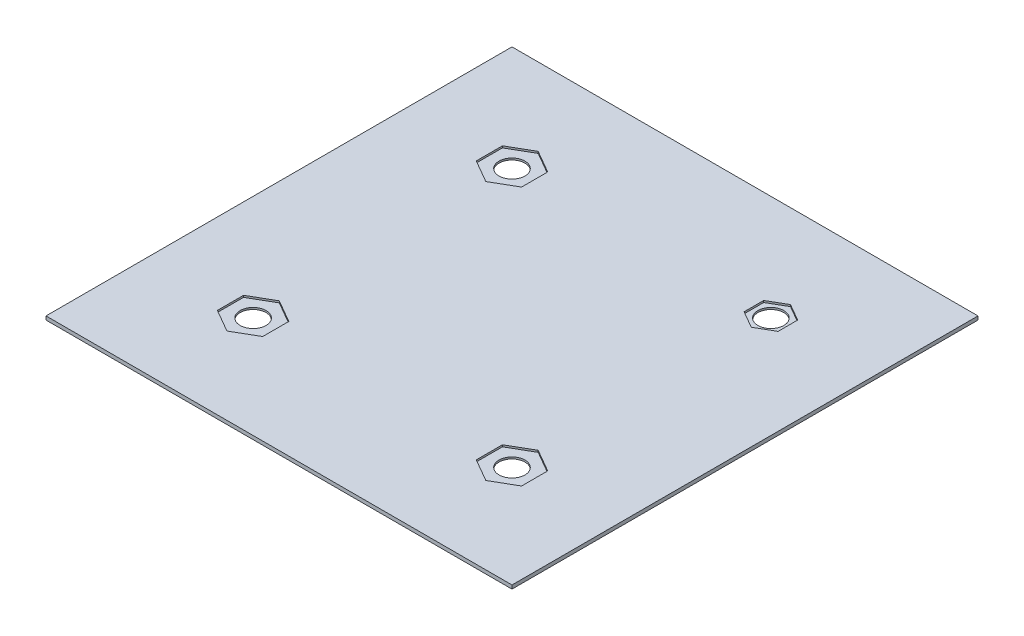
from build123d import *

# Parameters (mm, degrees)
SKETCH1_W           = 114.3
SKETCH1_H           = 114.3
BOSS_EXTRUDE1_DEPTH = 0.889
SKETCH2_R           = 3.175
CUT_EXTRUDE1_DEPTH  = 10
CUT_EXTRUDE2_DEPTH  = 0.4445


with BuildPart() as part:
    # Sketch1 → Boss-Extrude1 (new body)
    with BuildSketch(Plane(origin=(0, 0, 0), x_dir=(1, 0, 0), z_dir=(0, 1, 0))):
        with Locations((-26.758092486, 8.589017341)):
            Rectangle(SKETCH1_W, SKETCH1_H)
    extrude(amount=BOSS_EXTRUDE1_DEPTH)

    # Sketch2 → Cut-Extrude1 (cut)
    with BuildSketch(Plane(origin=(0, 0.889, 0), x_dir=(1, 0, 0), z_dir=(0, 1, 0))):
        with Locations((-58.508092486, 40.339017341)):
            Circle(SKETCH2_R)
        with Locations((4.991907514, 40.339017341)):
            Circle(SKETCH2_R)
        with Locations((-58.508092486, -23.160982659)):
            Circle(SKETCH2_R)
        with Locations((4.991907514, -23.160982659)):
            Circle(SKETCH2_R)
    extrude(amount=-CUT_EXTRUDE1_DEPTH, mode=Mode.SUBTRACT)

    # Sketch3 → Cut-Extrude2 (cut)
    with BuildSketch(Plane(origin=(0, 0.889, 0), x_dir=(1, 0, 0), z_dir=(0, 1, 0))):
        Polygon((-58.508092486, 46.754822207), (-64.064342486, 43.546919774), (-64.064342486, 37.131114908), (-58.508092486, 33.923212475), (-52.951842486, 37.131114908), (-52.951842486, 43.546919774), align=None)
        Polygon((4.991907514, 45.150870991), (0.824720014, 42.744944166), (0.824720014, 37.933090516), (4.991907514, 35.527163691), (9.159095014, 37.933090516), (9.159095014, 42.744944166), align=None)
        Polygon((-58.508092486, -16.745177793), (-64.064342486, -19.953080226), (-64.064342486, -26.368885092), (-58.508092486, -29.576787525), (-52.951842486, -26.368885092), (-52.951842486, -19.953080226), align=None)
        Polygon((4.991907514, -16.745177793), (-0.564342486, -19.953080226), (-0.564342486, -26.368885092), (4.991907514, -29.576787525), (10.548157514, -26.368885092), (10.548157514, -19.953080226), align=None)
    extrude(amount=-CUT_EXTRUDE2_DEPTH, mode=Mode.SUBTRACT)


solid = part.part
